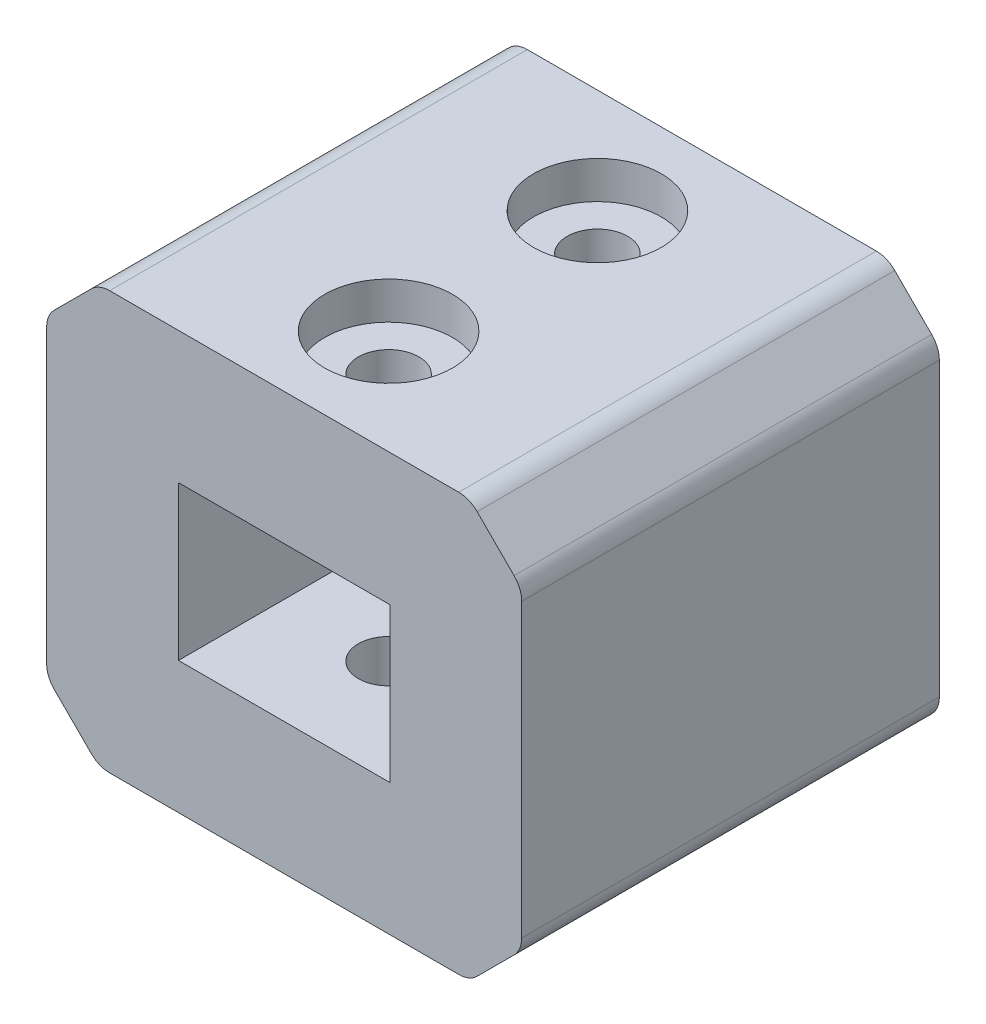
from build123d import *

# Parameters (mm, degrees)
SKETCH1_W                               = 45.5
SKETCH1_H                               = 40
SKETCH1_W_2                             = 20.25
SKETCH1_H_2                             = 14.75
BOSS_EXTRUDE1_DEPTH                     = 40
CHAMFER1_SIZE                           = 5
FILLET1_R                               = 2.5
CBORE_FOR_M5_HEX_HEAD_BOLT1_D           = 5.8
CBORE_FOR_M5_HEX_HEAD_BOLT1_CBORE_D     = 12.24
CBORE_FOR_M5_HEX_HEAD_BOLT1_CBORE_DEPTH = 3.58


with BuildPart() as part:
    # Sketch1 → Boss-Extrude1 (new body)
    with BuildSketch(Plane.XY):
        Rectangle(SKETCH1_W, SKETCH1_H)
        Rectangle(SKETCH1_W_2, SKETCH1_H_2, mode=Mode.SUBTRACT)
    extrude(amount=BOSS_EXTRUDE1_DEPTH)

    # Chamfer1
    chamfer1_edges = [part.edges().sort_by_distance(p)[0] for p in [
        (-22.75, 20, 20),
        (22.75, 20, 20),
        (22.75, -20, 20),
        (-22.75, -20, 20),
    ]]
    chamfer(chamfer1_edges, length=CHAMFER1_SIZE)

    # Fillet1
    fillet1_edges = [part.edges().sort_by_distance(p)[0] for p in [
        (17.75, 20, 20),
        (22.75, 15, 20),
        (22.75, -15, 20),
        (17.75, -20, 20),
        (-17.75, -20, 20),
        (-22.75, -15, 20),
        (-22.75, 15, 20),
        (-17.75, 20, 20),
    ]]
    fillet(fillet1_edges, radius=FILLET1_R)

    # CBORE for M5 Hex Head Bolt1 (through all)
    with Locations(Plane(origin=(0, 20, 0), x_dir=(1, 0, 0), z_dir=(0, 1, 0))):
        with Locations((0, -10)):
            cbore_for_m5_hex_head_bolt1 = CounterBoreHole(CBORE_FOR_M5_HEX_HEAD_BOLT1_D / 2, CBORE_FOR_M5_HEX_HEAD_BOLT1_CBORE_D / 2, CBORE_FOR_M5_HEX_HEAD_BOLT1_CBORE_DEPTH)

    # Mirror1: CBORE for M5 Hex Head Bolt1 across plane
    add(cbore_for_m5_hex_head_bolt1.mirror(Plane(origin=(0, 0, 20), x_dir=(1, 0, 0), z_dir=(0, 0, -1))), mode=Mode.SUBTRACT)


solid = part.part
